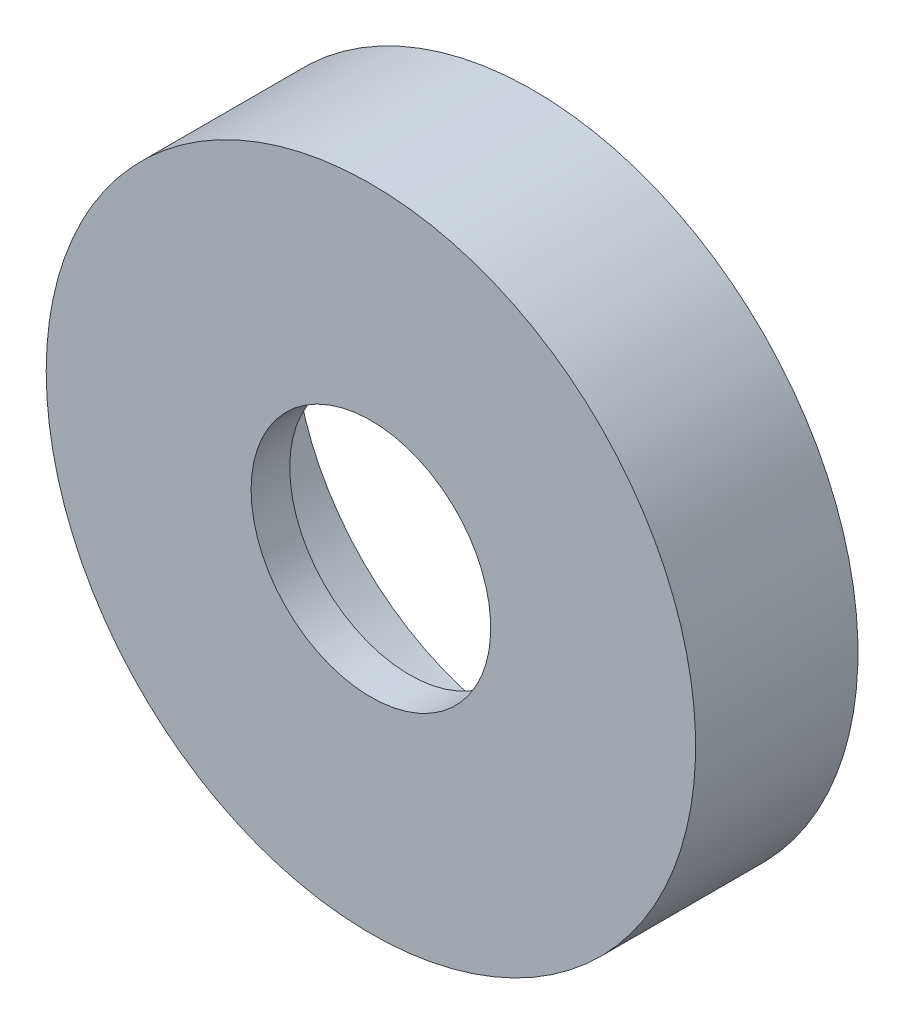
from build123d import *

# Parameters (mm, degrees)
SKETCH_1_R          = 42
EXTRUDE_1_DEPTH     = 21
SKETCH_2_R          = 31
CUT_EXTRUDE_2_DEPTH = 16
SKETCH_3_R          = 15.5
CUT_EXTRUDE_3_DEPTH = 62.514225997


with BuildPart() as part:
    # Эскиз1 → Вытянуть1 (new body)
    with BuildSketch(Plane.XY):
        Circle(SKETCH_1_R)
    extrude(amount=EXTRUDE_1_DEPTH)

    # Эскиз2 → Вытянуть2 (cut)
    with BuildSketch(Plane(origin=(0, 0, 0), x_dir=(-1, 0, 0), z_dir=(0, 0, -1))):
        Circle(SKETCH_2_R)
    extrude(amount=-CUT_EXTRUDE_2_DEPTH, mode=Mode.SUBTRACT)

    # Эскиз3 → Вытянуть3 (cut, through all)
    with BuildSketch(Plane(origin=(0, 0, 16), x_dir=(-1, 0, 0), z_dir=(0, 0, -1))):
        Circle(SKETCH_3_R)
    extrude(amount=-CUT_EXTRUDE_3_DEPTH, mode=Mode.SUBTRACT)


solid = part.part
